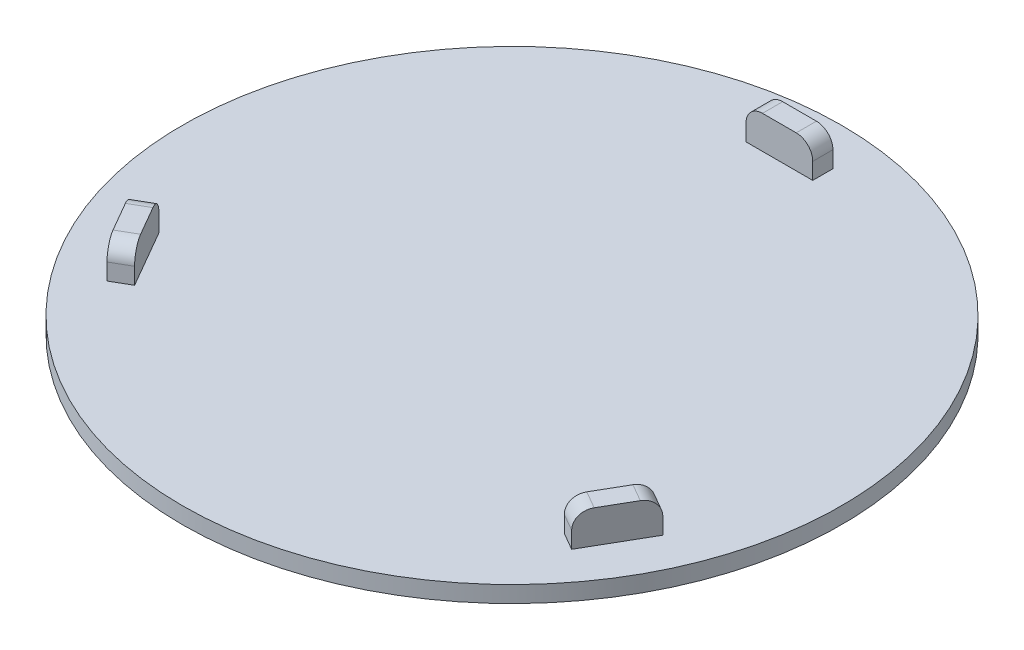
from build123d import *

# Parameters (mm, degrees)
SKETCH1_R           = 40
BOSS_EXTRUDE1_DEPTH = 2
SKETCH2_W           = 8.4
SKETCH2_H           = 2.75
BOSS_EXTRUDE2_DEPTH = 4
SKETCH3_R           = 36
SKETCH3_R_2         = 34
BOSS_EXTRUDE3_DEPTH = 2
FILLET2_R           = 1
CUT_EXTRUDE1_DEPTH  = 2
SKETCH5_W           = 8.4
SKETCH5_H           = 2.75
SKETCH5_W_2         = 8.1
SKETCH5_H_2         = 2.45
CUT_EXTRUDE2_DEPTH  = 4
FILLET3_R           = 2


with BuildPart() as part:
    # Sketch1 → Boss-Extrude1 (new body)
    with BuildSketch(Plane(origin=(0, 0, 0), x_dir=(1, 0, 0), z_dir=(0, 1, 0))):
        with Locations(Location((0, 0, 0), (0, 0, 270))):
            Circle(SKETCH1_R)
    extrude(amount=BOSS_EXTRUDE1_DEPTH)

    # Sketch2 → Boss-Extrude2 (add)
    with BuildSketch(Plane(origin=(0, 2, 0), x_dir=(1, 0, 0), z_dir=(0, 1, 0))):
        with Locations((0, 33.675)):
            Rectangle(SKETCH2_W, SKETCH2_H)
        Polygon((32.454190403, -13.887693304), (28.254190403, -21.162306696), (25.872620542, -19.787306696), (30.072620542, -12.512693304), align=None)
        Polygon((-28.254190403, -21.162306696), (-32.454190403, -13.887693304), (-30.072620542, -12.512693304), (-25.872620542, -19.787306696), align=None)
    extrude(amount=BOSS_EXTRUDE2_DEPTH)

    # Sketch3 → Boss-Extrude3 (add)
    with BuildSketch(Plane.XZ):
        with Locations(Location((0, 0, 0), (0, 0, 90))):
            Circle(SKETCH3_R)
        with Locations(Location((0, 0, 0), (0, 0, 270))):
            Circle(SKETCH3_R_2, mode=Mode.SUBTRACT)
    extrude(amount=BOSS_EXTRUDE3_DEPTH)

    # Fillet2
    fillet2_edges = [part.edges().sort_by_distance(p)[0] for p in [
        (0, -2, -36),
        (0, -2, 34),
    ]]
    fillet(fillet2_edges, radius=FILLET2_R - 0.0001)  # a hair under: the kernel refuses the full size

    # Sketch4 → Cut-Extrude1 (cut)
    with BuildSketch(Plane.XZ):
        Polygon((-1.5, -40), (-1.5, -1.5), (-40, -1.5), (-40, 1.5), (-1.5, 1.5), (-1.5, 40), (1.5, 40), (1.5, 1.5), (40, 1.5), (40, -1.5), (1.5, -1.5), (1.5, -40), align=None)
    extrude(amount=CUT_EXTRUDE1_DEPTH, mode=Mode.SUBTRACT)

    # Sketch5 → Cut-Extrude2 (cut)
    # profile 1 of 3: a face of its own
    with BuildSketch(Plane(origin=(0, 6, 0), x_dir=(1, 0, 0), z_dir=(0, 1, 0))):
        Polygon((32.454190403, -13.887693304), (30.072620542, -12.512693304), (25.872620542, -19.787306696), (28.254190403, -21.162306696), align=None)
        Polygon((32.249286592, -13.942597115), (30.127524353, -12.717597115), (26.077524353, -19.732402885), (28.199286592, -20.957402885), align=None, mode=Mode.SUBTRACT)
    # profile 2 of 3: a face of its own
    with BuildSketch(Plane(origin=(0, 6, 0), x_dir=(1, 0, 0), z_dir=(0, 1, 0))):
        Polygon((-28.254190403, -21.162306696), (-25.872620542, -19.787306696), (-30.072620542, -12.512693304), (-32.454190403, -13.887693304), align=None)
        Polygon((-28.199286592, -20.957402885), (-26.077524353, -19.732402885), (-30.127524353, -12.717597115), (-32.249286592, -13.942597115), align=None, mode=Mode.SUBTRACT)
    # profile 3 of 3: a face of its own
    with BuildSketch(Plane(origin=(0, 6, 0), x_dir=(1, 0, 0), z_dir=(0, 1, 0))):
        with Locations((0, 33.675)):
            Rectangle(SKETCH5_W, SKETCH5_H)
        with Locations((0, 33.675)):
            Rectangle(SKETCH5_W_2, SKETCH5_H_2, mode=Mode.SUBTRACT)
    extrude(amount=-CUT_EXTRUDE2_DEPTH, mode=Mode.SUBTRACT)

    # Fillet3
    fillet3_edges = [part.edges().sort_by_distance(p)[0] for p in [
        (31.188405472, 6, 13.330097115),
        (27.138405472, 6, 20.344902885),
        (-27.138405472, 6, 20.344902885),
        (-31.188405472, 6, 13.330097115),
        (-4.05, 6, -33.675),
        (4.05, 6, -33.675),
    ]]
    fillet(fillet3_edges, radius=FILLET3_R)


solid = part.part
